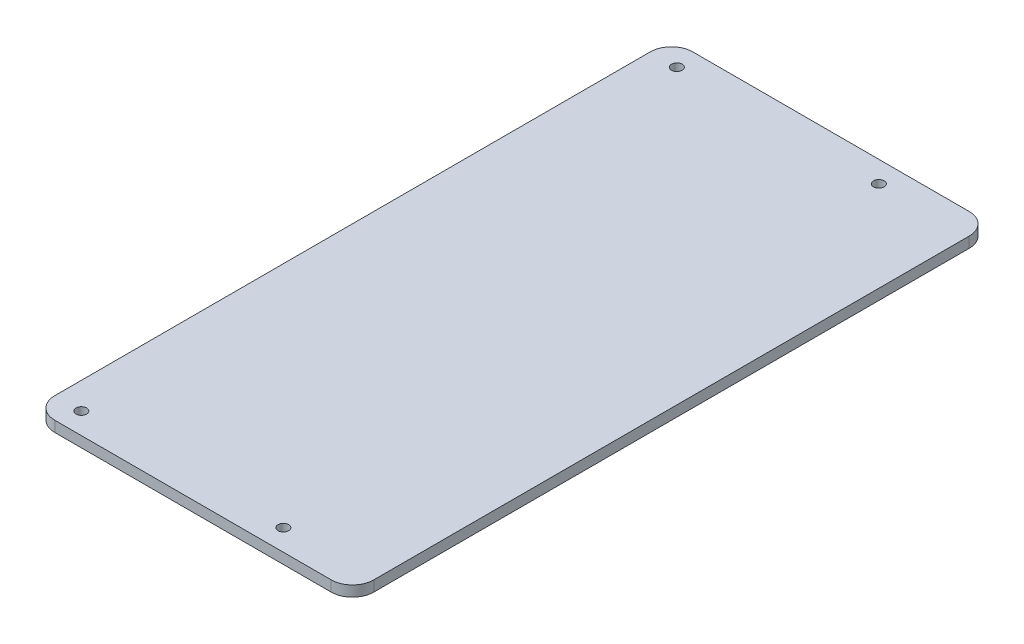
from build123d import *

# Parameters (mm, degrees)
SKETCH1_R           = 1.5
BOSS_EXTRUDE1_DEPTH = 3


with BuildPart() as part:
    # Sketch1 → Boss-Extrude1 (new body)
    with BuildSketch(Plane(origin=(0, 0, 0), x_dir=(1, 0, 0), z_dir=(0, 1, 0))):
        with BuildLine():
            Line((-39, -90), (39, -90))
            ThreePointArc((39, -90), (43.242640687, -88.242640687), (45, -84))
            Line((45, -84), (45, 84))
            ThreePointArc((45, 84), (43.242640687, 88.242640687), (39, 90))
            Line((39, 90), (-39, 90))
            ThreePointArc((-39, 90), (-43.242640687, 88.242640687), (-45, 84))
            Line((-45, 84), (-45, -84))
            ThreePointArc((-45, -84), (-43.242640687, -88.242640687), (-39, -90))
        make_face()
        with Locations((19.5, -84)):
            Circle(SKETCH1_R, mode=Mode.SUBTRACT)
        with Locations((-37.5, -84)):
            Circle(SKETCH1_R, mode=Mode.SUBTRACT)
        with Locations((19.5, 84)):
            Circle(SKETCH1_R, mode=Mode.SUBTRACT)
        with Locations((-37.5, 84)):
            Circle(SKETCH1_R, mode=Mode.SUBTRACT)
    extrude(amount=BOSS_EXTRUDE1_DEPTH)


solid = part.part
